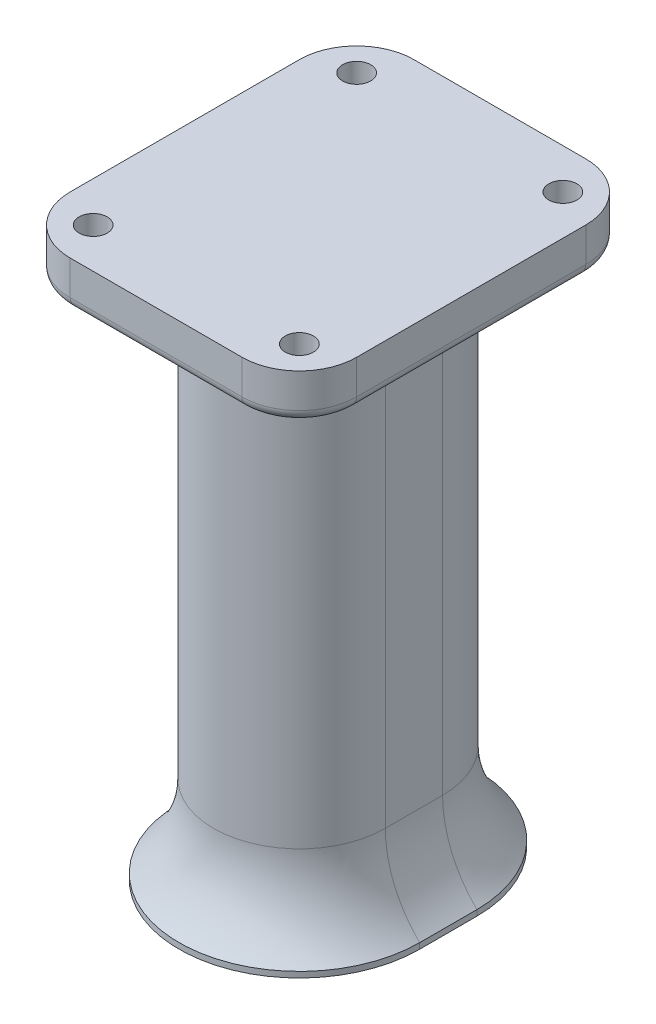
from build123d import *

# Parameters (mm, degrees)
BOSS_EXTRUDE1_DEPTH       = 90
BOSS_EXTRUDE2_DEPTH       = 1
SKETCH3_W                 = 50
SKETCH3_H                 = 60
BOSS_EXTRUDE3_DEPTH       = 8
FILLET1_R                 = 20
FILLET1_R_2               = 8
F_8_CLEARANCE_HOLE1_D     = 4.9149
F_8_CLEARANCE_HOLE1_DEPTH = 15
F_8_CLEARANCE_HOLE1_TIP   = 1.476584928
SKETCH8_R                 = 3.5
CUT_EXTRUDE2_DEPTH        = 12.7
CUT_EXTRUDE1_DEPTH        = 6
FILLET2_R                 = 10
FILLET3_R                 = 2
SKETCH9_R                 = 4.215
CUT_EXTRUDE3_DEPTH        = 3
MIRROR2_COPY_1_SKETCH_R   = 4.215
MIRROR2_COPY_1_DEPTH      = 3


# Some blends are built 0.0001 mm under size
with BuildPart() as part:
    # Sketch1 → Boss-Extrude1 (new body)
    with BuildSketch(Plane(origin=(0, 0, 0), x_dir=(1, 0, 0), z_dir=(0, 1, 0))):
        with BuildLine():
            Line((-15, -5), (-15, 5))
            ThreePointArc((-15, 5), (0, 20), (15, 5))
            Line((15, 5), (15, -5))
            ThreePointArc((15, -5), (0, -20), (-15, -5))
        make_face()
    extrude(amount=BOSS_EXTRUDE1_DEPTH)

    # Sketch2 → Boss-Extrude2 (add)
    with BuildSketch(Plane.XZ):
        with BuildLine():
            Line((-21, 5), (-21, -5))
            ThreePointArc((-21, -5), (0, -26), (21, -5))
            Line((21, -5), (21, 5))
            ThreePointArc((21, 5), (0, 26), (-21, 5))
        make_face()
    extrude(amount=BOSS_EXTRUDE2_DEPTH)

    # Sketch3 → Boss-Extrude3 (add)
    with BuildSketch(Plane(origin=(0, 90, 0), x_dir=(1, 0, 0), z_dir=(0, 1, 0))):
        Rectangle(SKETCH3_W, SKETCH3_H)
    extrude(amount=BOSS_EXTRUDE3_DEPTH)

    # Fillet1
    # the kernel refuses this fillet: 20, 8 mm, written as the material it adds along each edge
    with BuildSketch(Plane(origin=(0, 0, 5), x_dir=(1, 0, 0), z_dir=(0, 0, -1))) as fillet1_piece_1:
        with BuildLine():
            CenterArc((35, -14.282856857), FILLET1_R, 134.427004001, 45.572995999)
            Line((21, 0), (20.72, 0.285657137))
            ThreePointArc((20.72, 0.285657137), (18, 0.4), (15, 0.4))
            Line((15, 0.4), (14.6, 0))
            Line((14.6, 0), (14.6, -14.282856857))
            Line((14.6, -14.282856857), (15, -14.282856857))
        make_face()
    revolve(axis=Axis((0, 0, 5), (0, -1, 0)), revolution_arc=180)
    with BuildSketch(Plane(origin=(0, 90, 5), x_dir=(1, 0, 0), z_dir=(0, 0, -1))) as fillet1_piece_2:
        with BuildLine():
            CenterArc((15 + FILLET1_R_2, FILLET1_R_2), FILLET1_R_2, 180, 90)
            Line((15, FILLET1_R_2), (15 - FILLET1_R_2 * 0.02, FILLET1_R_2))
            Line((15 - FILLET1_R_2 * 0.02, FILLET1_R_2), (15 - FILLET1_R_2 * 0.02, -FILLET1_R_2 * 0.02))
            Line((15 - FILLET1_R_2 * 0.02, -FILLET1_R_2 * 0.02), (15 + FILLET1_R_2, -FILLET1_R_2 * 0.02))
            Line((15 + FILLET1_R_2, -FILLET1_R_2 * 0.02), (15 + FILLET1_R_2, 0))
        make_face()
    revolve(axis=Axis((0, 90, 5), (0, -1, 0)), revolution_arc=180)
    with BuildSketch(Plane(origin=(15, 90, -5), x_dir=(1, 0, 0), z_dir=(0, 0, 1)), Plane(origin=(-15, 90, 5), x_dir=(-1, 0, 0), z_dir=(0, 0, -1))) as fillet1_piece_3:
        with BuildLine():
            CenterArc((FILLET1_R_2, -FILLET1_R_2), FILLET1_R_2, 90, 90)
            Line((0, -FILLET1_R_2), (-FILLET1_R_2 * 0.02, -FILLET1_R_2))
            Line((-FILLET1_R_2 * 0.02, -FILLET1_R_2), (-FILLET1_R_2 * 0.02, FILLET1_R_2 * 0.02))
            Line((-FILLET1_R_2 * 0.02, FILLET1_R_2 * 0.02), (FILLET1_R_2, FILLET1_R_2 * 0.02))
            Line((FILLET1_R_2, FILLET1_R_2 * 0.02), (FILLET1_R_2, 0))
        make_face()
    extrude(amount=10)
    with BuildSketch(Plane(origin=(0, 90, -5), x_dir=(-1, 0, 0), z_dir=(0, 0, 1))) as fillet1_piece_4:
        with BuildLine():
            CenterArc((15 + FILLET1_R_2, FILLET1_R_2), FILLET1_R_2, 180, 90)
            Line((15, FILLET1_R_2), (15 - FILLET1_R_2 * 0.02, FILLET1_R_2))
            Line((15 - FILLET1_R_2 * 0.02, FILLET1_R_2), (15 - FILLET1_R_2 * 0.02, -FILLET1_R_2 * 0.02))
            Line((15 - FILLET1_R_2 * 0.02, -FILLET1_R_2 * 0.02), (15 + FILLET1_R_2, -FILLET1_R_2 * 0.02))
            Line((15 + FILLET1_R_2, -FILLET1_R_2 * 0.02), (15 + FILLET1_R_2, 0))
        make_face()
    revolve(axis=Axis((0, 90, -5), (0, -1, 0)), revolution_arc=180)
    with BuildSketch(Plane(origin=(15, 0, -5), x_dir=(0, 1, 0), z_dir=(0, 0, 1)), Plane(origin=(-15, 0, 5), x_dir=(0, 1, 0), z_dir=(0, 0, -1))) as fillet1_piece_5:
        with BuildLine():
            CenterArc((14.282856857, -20), FILLET1_R, 90, 45.572995999)
            Line((0, -6), (-0.285657137, -5.72))
            ThreePointArc((-0.285657137, -5.72), (-0.4, -3), (-0.4, 0))
            Line((-0.4, 0), (0, 0.4))
            Line((0, 0.4), (14.282856857, 0.4))
            Line((14.282856857, 0.4), (14.282856857, 0))
        make_face()
    extrude(amount=10)
    with BuildSketch(Plane(origin=(0, 0, -5), x_dir=(-1, 0, 0), z_dir=(0, 0, 1))) as fillet1_piece_6:
        with BuildLine():
            CenterArc((35, -14.282856857), FILLET1_R, 134.427004001, 45.572995999)
            Line((21, 0), (20.72, 0.285657137))
            ThreePointArc((20.72, 0.285657137), (18, 0.4), (15, 0.4))
            Line((15, 0.4), (14.6, 0))
            Line((14.6, 0), (14.6, -14.282856857))
            Line((14.6, -14.282856857), (15, -14.282856857))
        make_face()
    revolve(axis=Axis((0, 0, -5), (0, -1, 0)), revolution_arc=180)

    # #8 Clearance Hole1
    with Locations(Plane(origin=(0, 98, 0), x_dir=(1, 0, 0), z_dir=(0, 1, 0))):
        with Locations((-18, 23), (18, 23), (18, -23), (-18, -23)):
            Hole(F_8_CLEARANCE_HOLE1_D / 2, depth=F_8_CLEARANCE_HOLE1_DEPTH)
            with Locations((0, 0, -(F_8_CLEARANCE_HOLE1_DEPTH + F_8_CLEARANCE_HOLE1_TIP / 2))):  # 118° drill point
                Cone(0, F_8_CLEARANCE_HOLE1_D / 2, F_8_CLEARANCE_HOLE1_TIP, mode=Mode.SUBTRACT)

    # Sketch8 → Cut-Extrude2 (cut)
    with BuildSketch(Plane.XZ.offset(1)):
        with Locations(Location((0, 0, 0), (0, 0, 270))):
            Circle(SKETCH8_R)
    extrude(amount=-CUT_EXTRUDE2_DEPTH, mode=Mode.SUBTRACT)

    # Sketch7 → Cut-Extrude1 (cut)
    with BuildSketch(Plane.XZ.offset(1)):
        Polygon((-3.464101615, -6), (3.464101615, -6), (6.92820323, 0), (3.464101615, 6), (-3.464101615, 6), (-6.92820323, 0), align=None)
    extrude(amount=-CUT_EXTRUDE1_DEPTH, mode=Mode.SUBTRACT)

    # Fillet2
    fillet2_edges = [part.edges().sort_by_distance(p)[0] for p in [
        (-25, 94, -30),
        (-25, 94, 30),
        (25, 94, 30),
        (25, 94, -30),
    ]]
    fillet(fillet2_edges, radius=FILLET2_R)

    # Fillet3
    fillet3_edges = [part.edges().sort_by_distance(p)[0] for p in [
        (0, 90, 30),
        (-25, 90, 0),
        (0, 90, -30),
        (25, 90, 0),
        (22.071067812, 90, 27.071067812),
        (22.071067812, 90, -27.071067812),
        (-22.071067812, 90, -27.071067812),
        (-22.071067812, 90, 27.071067812),
    ]]
    fillet(fillet3_edges, radius=FILLET3_R - 0.0001)  # a hair under: the kernel refuses the full size

    # Sketch9 → Cut-Extrude3 (cut, symmetric)
    with BuildSketch(Plane.XZ.offset(-90)):
        with Locations(Location((18, -23, 0), (0, 0, 270))):
            Circle(SKETCH9_R)
    cut_extrude3 = extrude(amount=CUT_EXTRUDE3_DEPTH, both=True, mode=Mode.SUBTRACT)

    # Mirror1: Cut-Extrude3 across plane
    add(cut_extrude3.mirror(Plane(origin=(0, 0, 0), x_dir=(0, 0, 1), z_dir=(1, 0, 0))), mode=Mode.SUBTRACT)

    # Mirror2: Cut-Extrude3 across plane
    add(cut_extrude3.mirror(Plane.XY), mode=Mode.SUBTRACT)

    # Mirror2 copy 1 sketch → Mirror2 copy 1 (cut, symmetric)
    with BuildSketch(Plane(origin=(0, 90, 0), x_dir=(-1, 0, 0), z_dir=(0, -1, 0))):
        with Locations(Location((18, -23, 0), (0, 0, 270))):
            Circle(MIRROR2_COPY_1_SKETCH_R)
    extrude(amount=MIRROR2_COPY_1_DEPTH, both=True, mode=Mode.SUBTRACT)


solid = part.part
